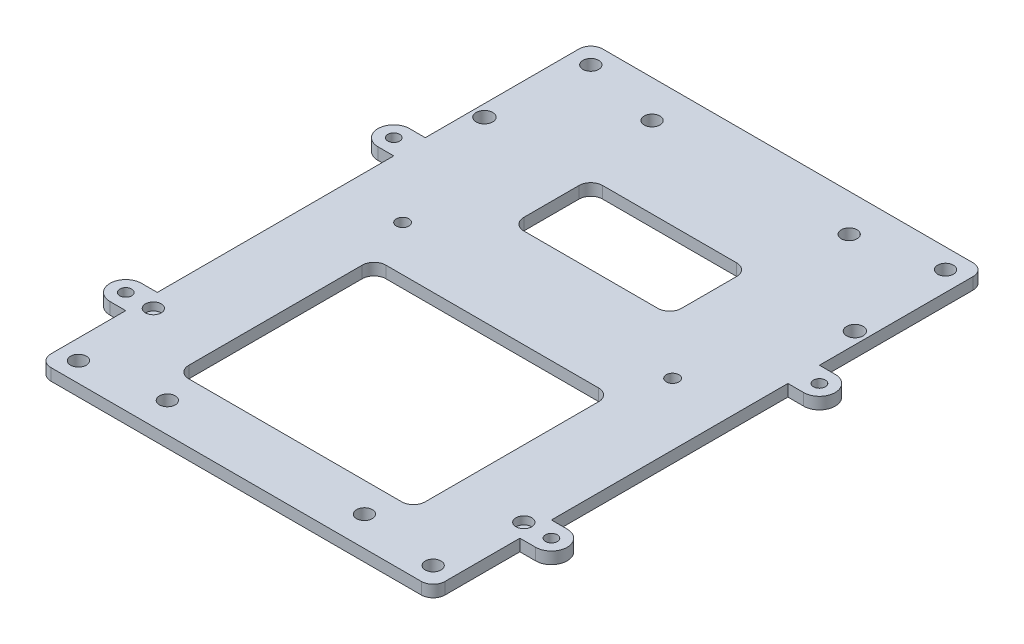
from build123d import *

# Parameters (mm, degrees)
SKETCH1_W                = 100
SKETCH1_H                = 140
SKETCH1_R                = 2
EXTRUDE1_DEPTH           = 2
SKETCH2_W                = 60
SKETCH2_H                = 50
EXTRUDE2_DEPTH           = 87.046499057
SKETCH3_W                = 40
SKETCH3_H                = 20
EXTRUDE3_DEPTH           = 87.046499057
FILLET1_R                = 3
SKETCH4_W                = 6
SKETCH4_H                = 8
EXTRUDE4_DEPTH           = 60
SKETCH5_R                = 1
EXTRUDE5_DEPTH           = 8
SKETCH6_R                = 2
SKETCH6_R_2              = 2.1
EXTRUDE6_DEPTH           = 10
EXTRUDE_START            = -3
SKETCH_3_R               = 1.5
EXTRUDE_1_DEPTH          = 3
CUT_EXTRUDE_3_DEPTH      = 29
CUT_EXTRUDE_3_DEPTH_BACK = 134
SKETCH_4_W               = 103.957976386
SKETCH_4_H               = 74.150098407
SKETCH_6_R               = 2
CUT_EXTRUDE_4_DEPTH      = 11
SKETCH_8_R               = 2
CUT_EXTRUDE_6_DEPTH      = 11
EXTRUDE_START_2          = 1
SKETCH_9_R               = 2
SKETCH_9_R_2             = 2.1
EXTRUDE_2_DEPTH          = 1
SKETCH_10_R              = 1.6
CUT_EXTRUDE_7_DEPTH      = 3


with BuildPart() as part:
    # Sketch1 → Extrude1 (new body)
    with BuildSketch(Plane(origin=(0, 0, 0), x_dir=(1, 0, 0), z_dir=(0, 1, 0))):
        Rectangle(SKETCH1_W, SKETCH1_H)
        with Locations((45, 65)):
            Circle(SKETCH1_R, mode=Mode.SUBTRACT)
        with Locations((-45, 65)):
            Circle(SKETCH1_R, mode=Mode.SUBTRACT)
        with Locations((-45, -65)):
            Circle(SKETCH1_R, mode=Mode.SUBTRACT)
        with Locations((45, -65)):
            Circle(SKETCH1_R, mode=Mode.SUBTRACT)
    extrude(amount=EXTRUDE1_DEPTH)

    # Sketch2 → Extrude2 (cut, through all)
    with BuildSketch(Plane(origin=(0, 2, 0), x_dir=(1, 0, 0), z_dir=(0, 1, 0))):
        with Locations((0, -30)):
            Rectangle(SKETCH2_W, SKETCH2_H)
    extrude(amount=-EXTRUDE2_DEPTH, mode=Mode.SUBTRACT)

    # Sketch3 → Extrude3 (cut, through all)
    with BuildSketch(Plane(origin=(0, 2, 0), x_dir=(1, 0, 0), z_dir=(0, 1, 0))):
        with Locations((0, 30)):
            Rectangle(SKETCH3_W, SKETCH3_H)
    extrude(amount=-EXTRUDE3_DEPTH, mode=Mode.SUBTRACT)

    # Fillet1
    fillet1_edges = [part.edges().sort_by_distance(p)[0] for p in [
        (50, 1, 70),
        (-50, 1, 70),
        (-50, 1, -70),
        (30, 1, 5),
        (-30, 1, 5),
        (-30, 1, 55),
        (30, 1, 55),
        (-20, 1, -20),
        (20, 1, -20),
        (20, 1, -40),
        (-20, 1, -40),
        (50, 1, -70),
    ]]
    fillet(fillet1_edges, radius=FILLET1_R)

    # Sketch4 → Extrude4 (add)
    with BuildSketch(Plane.XZ):
        with Locations((47, 44)):
            Rectangle(SKETCH4_W, SKETCH4_H)
        with Locations((47, -24)):
            Rectangle(SKETCH4_W, SKETCH4_H)
        with Locations((-47, -24)):
            Rectangle(SKETCH4_W, SKETCH4_H)
        with Locations((-47, 44)):
            Rectangle(SKETCH4_W, SKETCH4_H)
    extrude(amount=EXTRUDE4_DEPTH)

    # Sketch5 → Extrude5 (add)
    # profile 1 of 4: a face of its own
    with BuildSketch(Plane.XZ.offset(60)):
        with BuildLine():
            Line((44, 40), (44, 48))
            Line((44, 48), (54, 48))
            ThreePointArc((54, 48), (58, 44), (54, 40))
            Line((54, 40), (44, 40))
        make_face()
        with Locations((54, 44)):
            Circle(SKETCH5_R, mode=Mode.SUBTRACT)
    # profile 2 of 4: a face of its own
    with BuildSketch(Plane.XZ.offset(60)):
        with BuildLine():
            Line((44, -28), (44, -20))
            Line((44, -20), (54, -20))
            ThreePointArc((54, -20), (58, -24), (54, -28))
            Line((54, -28), (44, -28))
        make_face()
        with Locations((54, -24)):
            Circle(SKETCH5_R, mode=Mode.SUBTRACT)
    # profile 3 of 4: a face of its own
    with BuildSketch(Plane.XZ.offset(60)):
        with BuildLine():
            Line((-44, -20), (-54, -20))
            ThreePointArc((-54, -20), (-58, -24), (-54, -28))
            Line((-54, -28), (-44, -28))
            Line((-44, -28), (-44, -20))
        make_face()
        with Locations((-54, -24)):
            Circle(SKETCH5_R, mode=Mode.SUBTRACT)
    # profile 4 of 4: a face of its own
    with BuildSketch(Plane.XZ.offset(60)):
        with BuildLine():
            Line((-44, 48), (-54, 48))
            ThreePointArc((-54, 48), (-58, 44), (-54, 40))
            Line((-54, 40), (-44, 40))
            Line((-44, 40), (-44, 48))
        make_face()
        with Locations((-54, 44)):
            Circle(SKETCH5_R, mode=Mode.SUBTRACT)
    extrude(amount=-EXTRUDE5_DEPTH)

    # Sketch6 → Extrude6 (cut)
    with BuildSketch(Plane(origin=(0, 0, 0), x_dir=(-1, 0, 0), z_dir=(0, -1, 0))):
        with Locations((-47, -44)):
            Circle(SKETCH6_R)
        with Locations((-47, 40)):
            Circle(SKETCH6_R_2)
        with Locations((47, 40)):
            Circle(SKETCH6_R_2)
        with Locations((47, -44)):
            Circle(SKETCH6_R)
    extrude(amount=-EXTRUDE6_DEPTH, mode=Mode.SUBTRACT)

    # 草图3 → 凸台-拉伸1 (add)
    # profile 1 of 4: a face of its own
    with BuildSketch(Plane(origin=(0, 2, 0), x_dir=(1, 0, 0), z_dir=(0, 1, 0)).offset(EXTRUDE_START)):
        with BuildLine():
            Line((50, 28), (50, 20))
            Line((50, 20), (54, 20))
            ThreePointArc((54, 20), (58, 24), (54, 28))
            Line((54, 28), (50, 28))
        make_face()
        with Locations((54, 24)):
            Circle(SKETCH_3_R, mode=Mode.SUBTRACT)
    # profile 2 of 4: a face of its own
    with BuildSketch(Plane(origin=(0, 2, 0), x_dir=(1, 0, 0), z_dir=(0, 1, 0)).offset(EXTRUDE_START)):
        with BuildLine():
            Line((50, -40), (50, -48))
            Line((50, -48), (54, -48))
            ThreePointArc((54, -48), (58, -44), (54, -40))
            Line((54, -40), (50, -40))
        make_face()
        with Locations((54, -44)):
            Circle(SKETCH_3_R, mode=Mode.SUBTRACT)
    # profile 3 of 4: a face of its own
    with BuildSketch(Plane(origin=(0, 2, 0), x_dir=(1, 0, 0), z_dir=(0, 1, 0)).offset(EXTRUDE_START)):
        with BuildLine():
            Line((-54, -48), (-50, -48))
            Line((-50, -48), (-50, -40))
            Line((-50, -40), (-54, -40))
            ThreePointArc((-54, -40), (-58, -44), (-54, -48))
        make_face()
        with Locations((-54, -44)):
            Circle(SKETCH_3_R, mode=Mode.SUBTRACT)
    # profile 4 of 4: a face of its own
    with BuildSketch(Plane(origin=(0, 2, 0), x_dir=(1, 0, 0), z_dir=(0, 1, 0)).offset(EXTRUDE_START)):
        with BuildLine():
            Line((-50, 20), (-50, 28))
            Line((-50, 28), (-54, 28))
            ThreePointArc((-54, 28), (-58, 24), (-54, 20))
            Line((-54, 20), (-50, 20))
        make_face()
        with Locations((-54, 24)):
            Circle(SKETCH_3_R, mode=Mode.SUBTRACT)
    extrude(amount=EXTRUDE_1_DEPTH)

    # 草图4 → 切除-拉伸3 (cut, two sides: drawn at the far end of the back side and taken through both)
    with BuildSketch(Plane(origin=(50, 0, 0), x_dir=(0, 0, -1), z_dir=(1, 0, 0)).offset(-CUT_EXTRUDE_3_DEPTH_BACK)):
        with Locations((3.978988193, -38.075049204)):
            Rectangle(SKETCH_4_W, SKETCH_4_H)
    extrude(amount=CUT_EXTRUDE_3_DEPTH + CUT_EXTRUDE_3_DEPTH_BACK, mode=Mode.SUBTRACT)

    # 草图6 → 切除-拉伸4 (cut)
    with BuildSketch(Plane(origin=(0, 2, 0), x_dir=(1, 0, 0), z_dir=(0, 1, 0))):
        with Locations((-25, 60.55)):
            Circle(SKETCH_6_R)
        with Locations((25, 60.55)):
            Circle(SKETCH_6_R)
    extrude(amount=-CUT_EXTRUDE_4_DEPTH, mode=Mode.SUBTRACT)

    # 草图8 → 切除-拉伸6 (cut)
    with BuildSketch(Plane(origin=(0, 0, 0), x_dir=(-1, 0, 0), z_dir=(0, -1, 0))):
        with Locations((25, -62.44)):
            Circle(SKETCH_8_R)
        with Locations((-25, -62.44)):
            Circle(SKETCH_8_R)
    extrude(amount=-CUT_EXTRUDE_6_DEPTH, mode=Mode.SUBTRACT)

    # 草图9 → 凸台-拉伸2 (add)
    with BuildSketch(Plane.XZ.offset(EXTRUDE_START_2)):
        with BuildLine():
            Line((-44, 40), (-50, 40))
            Line((-50, 40), (-50, -20))
            Line((-50, -20), (-44, -20))
            Line((-44, -20), (-44, -28))
            Line((-44, -28), (-50, -28))
            Line((-50, -28), (-50, -67))
            ThreePointArc((-50, -67), (-49.121320344, -69.121320344), (-47, -70))
            Line((-47, -70), (47, -70))
            ThreePointArc((47, -70), (49.121320344, -69.121320344), (50, -67))
            Line((50, -67), (50, -28))
            Line((50, -28), (44, -28))
            Line((44, -28), (44, -20))
            Line((44, -20), (50, -20))
            Line((50, -20), (50, 40))
            Line((50, 40), (44, 40))
            Line((44, 40), (44, 48))
            Line((44, 48), (50, 48))
            Line((50, 48), (50, 67))
            ThreePointArc((50, 67), (49.121320344, 69.121320344), (47, 70))
            Line((47, 70), (-47, 70))
            ThreePointArc((-47, 70), (-49.121320344, 69.121320344), (-50, 67))
            Line((-50, 67), (-50, 48))
            Line((-50, 48), (-44, 48))
            Line((-44, 48), (-44, 40))
        make_face()
        with Locations((-45, 65)):
            Circle(SKETCH_9_R, mode=Mode.SUBTRACT)
        with Locations((-25, 62.44)):
            Circle(SKETCH_9_R, mode=Mode.SUBTRACT)
        with Locations((45, 65)):
            Circle(SKETCH_9_R, mode=Mode.SUBTRACT)
        with Locations((25, 62.44)):
            Circle(SKETCH_9_R, mode=Mode.SUBTRACT)
        with Locations((47, -40)):
            Circle(SKETCH_9_R_2, mode=Mode.SUBTRACT)
        with Locations((45, -65)):
            Circle(SKETCH_9_R, mode=Mode.SUBTRACT)
        with Locations((25, -60.55)):
            Circle(SKETCH_9_R, mode=Mode.SUBTRACT)
        with Locations((-45, -65)):
            Circle(SKETCH_9_R, mode=Mode.SUBTRACT)
        with Locations((-47, -40)):
            Circle(SKETCH_9_R_2, mode=Mode.SUBTRACT)
        with Locations((-25, -60.55)):
            Circle(SKETCH_9_R, mode=Mode.SUBTRACT)
        with BuildLine():
            Line((30, 52), (30, 8))
            ThreePointArc((30, 8), (29.121320344, 5.878679656), (27, 5))
            Line((27, 5), (-27, 5))
            ThreePointArc((-27, 5), (-29.121320344, 5.878679656), (-30, 8))
            Line((-30, 8), (-30, 52))
            ThreePointArc((-30, 52), (-29.121320344, 54.121320344), (-27, 55))
            Line((-27, 55), (27, 55))
            ThreePointArc((27, 55), (29.121320344, 54.121320344), (30, 52))
        make_face(mode=Mode.SUBTRACT)
        with BuildLine():
            Line((20, -23), (20, -37))
            ThreePointArc((20, -37), (19.121320344, -39.121320344), (17, -40))
            Line((17, -40), (-17, -40))
            ThreePointArc((-17, -40), (-19.121320344, -39.121320344), (-20, -37))
            Line((-20, -37), (-20, -23))
            ThreePointArc((-20, -23), (-19.121320344, -20.878679656), (-17, -20))
            Line((-17, -20), (17, -20))
            ThreePointArc((17, -20), (19.121320344, -20.878679656), (20, -23))
        make_face(mode=Mode.SUBTRACT)
    extrude(amount=-EXTRUDE_2_DEPTH)

    # 草图10 → 切除-拉伸7 (cut)
    with BuildSketch(Plane(origin=(0, -1, 0), x_dir=(-1, 0, 0), z_dir=(0, -1, 0))):
        with Locations((34.25, 6.5)):
            Circle(SKETCH_10_R)
        with Locations((-34.25, 6.5)):
            Circle(SKETCH_10_R)
    extrude(amount=-CUT_EXTRUDE_7_DEPTH, mode=Mode.SUBTRACT)


solid = part.part
